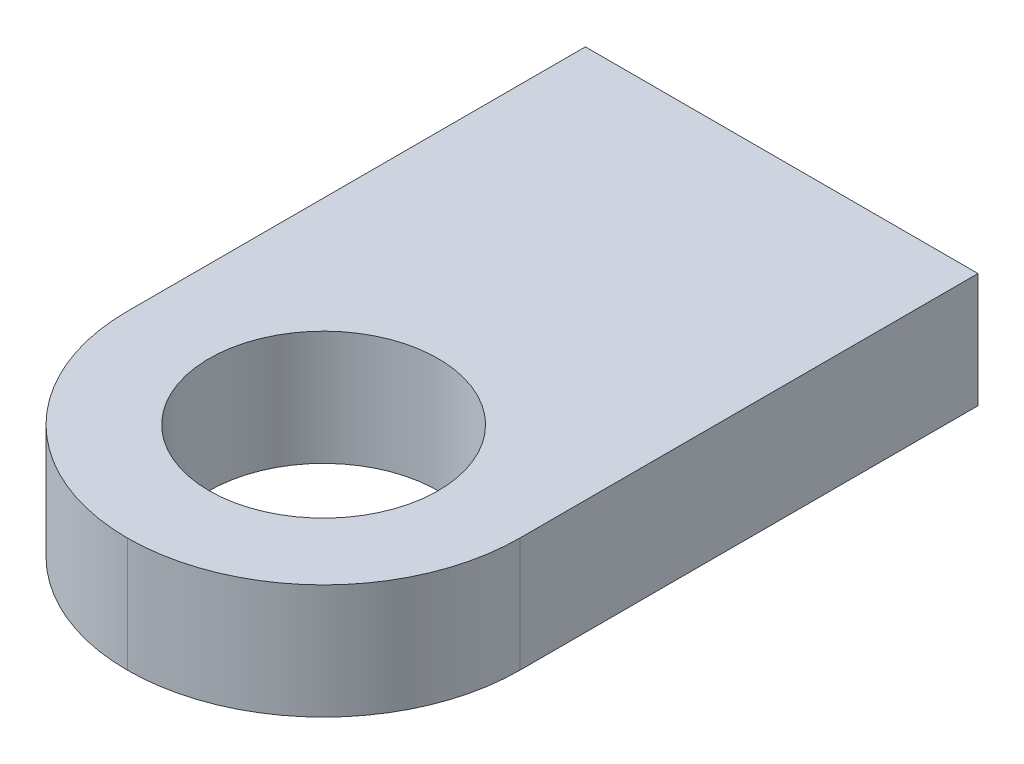
from build123d import *

# Parameters (mm, degrees)
BOSS_EXTRUDE1_DEPTH     = 5
SKETCH2_W               = 3.5
SKETCH2_H               = 12
SKETCH2_W_2             = 3
BOSS_EXTRUDE2_DEPTH     = 20
SKETCH3_W               = 12
SKETCH3_H               = 3
SKETCH3_H_2             = 3.5
BOSS_EXTRUDE3_DEPTH     = 20
SKETCH4_W               = 5
SKETCH4_H               = 8
BOSS_EXTRUDE4_DEPTH     = 18
SKETCH5_R               = 3.5
CUT_EXTRUDE1_DEPTH      = 3.5
SKETCH6_R               = 3.5
CUT_EXTRUDE2_DEPTH      = 3.5
SKETCH7_R               = 1.625
CUT_EXTRUDE3_DEPTH      = 5
SKETCH8_R               = 2.5
CUT_EXTRUDE4_DEPTH      = 3
SKETCH9_R               = 2.5
CUT_EXTRUDE5_DEPTH      = 3
FILLET1_R               = 6
FILLET2_R               = 2
FILLET4_R               = 4
SURFACECUT2_START       = -20
SURFACECUT2_DEPTH       = 25
SURFACECUT2_START_2     = 5
SURFACECUT2_2_OUTLINE_W = 12
SURFACECUT2_2_OUTLINE_H = 3
SURFACECUT2_2_DEPTH     = 20


# Read off the part's stored shape, not the designer's step: SurfaceCut2
with BuildPart() as part:
    # Sketch1 → Boss-Extrude1 (new body)
    with BuildSketch(Plane.XY):
        Polygon((21.1, 0), (38.5, 0), (38.5, 12), (17.6, 12), (17.6, 26), (12.6, 26), (12.6, 12), (0, 12), (0, 0), (9.1, 0), (9.1, -26.5), (21.1, -26.5), align=None)
    extrude(amount=BOSS_EXTRUDE1_DEPTH)

    # Sketch2 → Boss-Extrude2 (add)
    with BuildSketch(Plane(origin=(0, 0, 0), x_dir=(-1, 0, 0), z_dir=(0, 0, -1))):
        with Locations((-1.75, 6)):
            Rectangle(SKETCH2_W, SKETCH2_H)
        with Locations((-37, 6)):
            Rectangle(SKETCH2_W_2, SKETCH2_H)
    extrude(amount=BOSS_EXTRUDE2_DEPTH)

    # Sketch3 → Boss-Extrude3 (add)
    with BuildSketch(Plane.XY.offset(5)):
        with Locations((15.1, -25)):
            Rectangle(SKETCH3_W, SKETCH3_H)
        with Locations((15.1, 10.25)):
            Rectangle(SKETCH3_W, SKETCH3_H_2)
    extrude(amount=BOSS_EXTRUDE3_DEPTH)

    # Sketch4 → Boss-Extrude4 (add)
    with BuildSketch(Plane(origin=(0, 0, 0), x_dir=(-1, 0, 0), z_dir=(0, 0, -1))):
        with Locations((-15.1, 22)):
            Rectangle(SKETCH4_W, SKETCH4_H)
    extrude(amount=BOSS_EXTRUDE4_DEPTH)

    # Sketch5 → Cut-Extrude1 (cut)
    with BuildSketch(Plane.ZY):
        with Locations((-14, 6)):
            Circle(SKETCH5_R)
    extrude(amount=-CUT_EXTRUDE1_DEPTH, mode=Mode.SUBTRACT)

    # Sketch6 → Cut-Extrude2 (cut)
    with BuildSketch(Plane(origin=(0, 12, 0), x_dir=(1, 0, 0), z_dir=(0, 1, 0))):
        with Locations(Location((15.1, -19, 0), (0, 0, 270))):
            Circle(SKETCH6_R)
    extrude(amount=-CUT_EXTRUDE2_DEPTH, mode=Mode.SUBTRACT)

    # Sketch7 → Cut-Extrude3 (cut)
    with BuildSketch(Plane.ZY.offset(-12.6)):
        with Locations((-14, 22)):
            Circle(SKETCH7_R)
    extrude(amount=-CUT_EXTRUDE3_DEPTH, mode=Mode.SUBTRACT)

    # Sketch8 → Cut-Extrude4 (cut)
    with BuildSketch(Plane.ZY.offset(-35.5)):
        with Locations((-14, 6)):
            Circle(SKETCH8_R)
    extrude(amount=-CUT_EXTRUDE4_DEPTH, mode=Mode.SUBTRACT)

    # Sketch9 → Cut-Extrude5 (cut)
    with BuildSketch(Plane(origin=(0, -23.5, 0), x_dir=(1, 0, 0), z_dir=(0, 1, 0))):
        with Locations(Location((15.1, -19, 0), (0, 0, 270))):
            Circle(SKETCH9_R)
    extrude(amount=-CUT_EXTRUDE5_DEPTH, mode=Mode.SUBTRACT)

    # Fillet1
    fillet1_edges = [part.edges().sort_by_distance(p)[0] for p in [
        (21.1, -25, 25),
        (9.1, -25, 25),
        (37, 0, -20),
        (37, 12, -20),
        (21.1, 10.25, 25),
        (9.1, 10.25, 25),
        (1.75, 0, -20),
        (1.75, 12, -20),
    ]]
    fillet(fillet1_edges, radius=FILLET1_R - 0.0001)  # a hair under: the kernel refuses the full size

    # Fillet2
    fillet2_edges = [part.edges().sort_by_distance(p)[0] for p in [
        (15.1, -26.5, 0),
        (38.5, 6, 5),
        (0, 6, 5),
        (15.1, 18, 0),
    ]]
    fillet(fillet2_edges, radius=FILLET2_R)

    # Fillet4
    fillet4_edges = [part.edges().sort_by_distance(p)[0] for p in [
        (15.1, 26, 5),
        (15.1, 26, -18),
        (15.1, 18, -18),
    ]]
    fillet(fillet4_edges, radius=FILLET4_R - 0.0001)  # a hair under: the kernel refuses the full size

    # SurfaceCut2 outline → SurfaceCut2 (cut)
    with BuildSketch(Plane.XY.offset(SURFACECUT2_START)):
        Polygon((0, 12), (0, 0), (9.1, 0), (9.1, -26.5), (21.1, -26.5), (21.1, 0), (38.5, 0), (38.5, 12), (17.6, 12), (17.6, 26), (12.6, 26), (12.6, 12), align=None)
    extrude(amount=SURFACECUT2_DEPTH, mode=Mode.SUBTRACT)

    # SurfaceCut2 2 outline → SurfaceCut2 2 (cut)
    with BuildSketch(Plane.XY.offset(SURFACECUT2_START_2)):
        with Locations((15.1, -25)):
            Rectangle(SURFACECUT2_2_OUTLINE_W, SURFACECUT2_2_OUTLINE_H)
    extrude(amount=SURFACECUT2_2_DEPTH, mode=Mode.SUBTRACT)


solid = part.part
